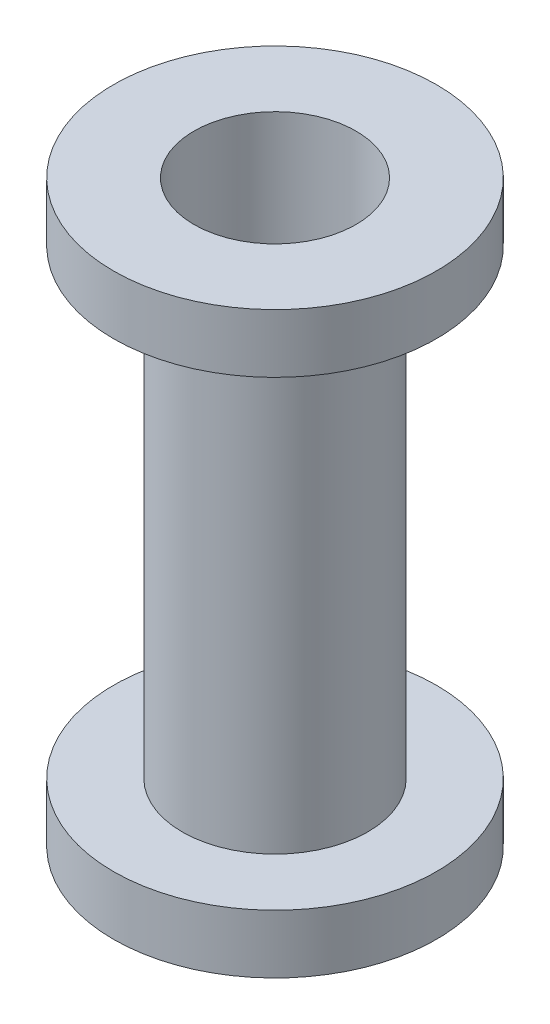
from build123d import *

# Parameters (mm, degrees)
SKETCH1_R      = 20.066
SKETCH1_R_2    = 17.526
EXTRUDE1_DEPTH = 125.222
EXTRUDE2_START = -12.7
SKETCH2_R      = 34.925
SKETCH2_R_2    = 17.526
EXTRUDE2_DEPTH = 12.7
SKETCH3_R      = 34.925
SKETCH3_R_2    = 17.526
EXTRUDE3_DEPTH = 12.7


with BuildPart() as part:
    # Sketch1 → Extrude1 (new body)
    with BuildSketch(Plane(origin=(0, 0, 0), x_dir=(1, 0, 0), z_dir=(0, 1, 0))):
        Circle(SKETCH1_R)
        Circle(SKETCH1_R_2, mode=Mode.SUBTRACT)
    extrude(amount=EXTRUDE1_DEPTH)

    # Sketch2 → Extrude2 (add)
    with BuildSketch(Plane(origin=(0, 125.222, 0), x_dir=(1, 0, 0), z_dir=(0, 1, 0)).offset(EXTRUDE2_START)):
        Circle(SKETCH2_R)
        Circle(SKETCH2_R_2, mode=Mode.SUBTRACT)
    extrude(amount=EXTRUDE2_DEPTH)

    # Sketch3 → Extrude3 (add)
    with BuildSketch(Plane.XZ):
        Circle(SKETCH3_R)
        Circle(SKETCH3_R_2, mode=Mode.SUBTRACT)
    extrude(amount=-EXTRUDE3_DEPTH)


solid = part.part
